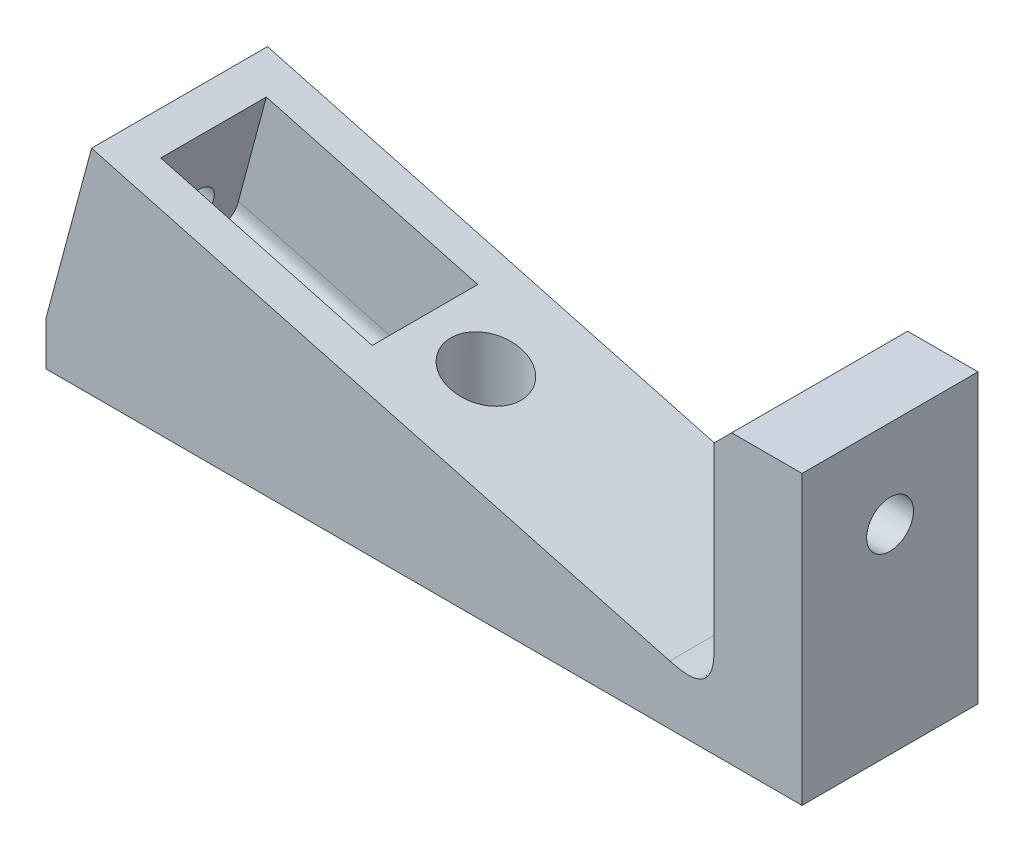
from build123d import *

# Parameters (mm, degrees)
BOSS_EXTRUDE2_DEPTH         = 12.7
CUT_EXTRUDE1_DEPTH          = 7.62
SKETCH3_R                   = 3.3
CUT_EXTRUDE3_DEPTH          = 5.08
FILLET1_SIZE                = 2.54
F_1_4_CLEARANCE_HOLE1_D     = 6.7564
SKETCH8_R                   = 5.08
CUT_EXTRUDE4_DEPTH          = 125.929525349
CUT_EXTRUDE5_DEPTH          = 129.230913422
BOSS_EXTRUDE3_DEPTH         = 25.4
F_1_4_CLEARANCE_HOLE2_D     = 6.7564
F_1_4_CLEARANCE_HOLE2_DEPTH = 12.7
F_1_4_CLEARANCE_HOLE2_TIP   = 2.029827343
SKETCH14_R                  = 5.08
CUT_EXTRUDE6_DEPTH          = 6.604
CHAMFER1_SIZE               = 2.54


with BuildPart() as part:
    # Sketch1 → Boss-Extrude2 (new, symmetric)
    with BuildSketch(Plane.XY):
        Polygon((-121.836586579, 6.35), (-121.836586579, 0), (0, 0), (-115.262582833, 30.884515988), align=None)
    extrude(amount=BOSS_EXTRUDE2_DEPTH, both=True)

    # Sketch2 → Cut-Extrude1 (cut, symmetric)
    with BuildSketch(Plane.XY):
        Polygon((-112.78857866, 20.490012472), (-112.245058665, 22.518456707), (-106.256318542, 20.913778627), (-109.051564229, 10.481779703), (-115.040304352, 12.086457783), (-114.496784358, 14.114902018), align=None)
        Polygon((-79.832423525, 21.391033413), (-110.355679636, 29.569715239), (-112.245058665, 22.518456707), (-106.256318542, 20.913778627), (-109.051564229, 10.481779703), (-84.517048242, 3.907775958), align=None)
    extrude(amount=CUT_EXTRUDE1_DEPTH, both=True, mode=Mode.SUBTRACT)

    # Sketch3 → Cut-Extrude3 (cut)
    with BuildSketch(Plane(origin=(-115.262582833, 30.884515988, 0), x_dir=(0, 0, 1), z_dir=(-0.96592582628907, 0.25881904510251447, 0))):
        with Locations(Location((0, -12.7, 0), (0, 0, 270))):
            Circle(SKETCH3_R)
    extrude(amount=-CUT_EXTRUDE3_DEPTH, mode=Mode.SUBTRACT)

    # Fillet1
    # a fillet whose section is not a circle: 2.54 mm, written as the material it adds along each edge
    with BuildSketch(Plane(origin=(-84.517048242, 3.907775958, 7.62), x_dir=(0.25881904510251297, 0.9659258262890703, 0), z_dir=(0, 0, -1))) as fillet1_piece_1:
        with BuildLine():
            add(Edge.make_bspline([(FILLET1_SIZE, 0), (FILLET1_SIZE * 0.831801948466, 0), (FILLET1_SIZE * 0.663603896932, 0), (FILLET1_SIZE * 0.292893218813, -FILLET1_SIZE * 0.0716919198361), (FILLET1_SIZE * 0.0716919198361, -FILLET1_SIZE * 0.292893218813), (0, -FILLET1_SIZE * 0.663603896932), (0, -FILLET1_SIZE * 0.831801948466), (0, -FILLET1_SIZE)], knots=[0, 0, 0, 0, 0, 0, 0.5, 0.5, 1, 1, 1, 1, 1, 1], degree=5))
            Line((0, -FILLET1_SIZE), (0, 0))
            Line((0, 0), (FILLET1_SIZE, 0))
        make_face()
    extrude(amount=15.24)
    with BuildSketch(Plane(origin=(-115.040304352, 12.086457783, 7.62), x_dir=(0.25881904510251585, 0.9659258262890695, 0), z_dir=(0.9659258262890696, -0.2588190451025158, 0))) as fillet1_piece_2:
        with BuildLine():
            add(Edge.make_bspline([(FILLET1_SIZE, 0), (FILLET1_SIZE * 0.831801948466, 0), (FILLET1_SIZE * 0.663603896932, 0), (FILLET1_SIZE * 0.292893218813, -FILLET1_SIZE * 0.0716919198361), (FILLET1_SIZE * 0.0716919198361, -FILLET1_SIZE * 0.292893218813), (0, -FILLET1_SIZE * 0.663603896932), (0, -FILLET1_SIZE * 0.831801948466), (0, -FILLET1_SIZE)], knots=[0, 0, 0, 0, 0, 0, 0.5, 0.5, 1, 1, 1, 1, 1, 1], degree=5))
            Line((0, -FILLET1_SIZE), (0, 0))
            Line((0, 0), (FILLET1_SIZE, 0))
        make_face()
    extrude(amount=37.95)
    with BuildSketch(Plane(origin=(-115.040304352, 12.086457783, -7.62), x_dir=(0.25881904510251585, 0.9659258262890695, 0), z_dir=(0.9659258262890696, -0.2588190451025158, 0))) as fillet1_piece_3:
        with BuildLine():
            add(Edge.make_bspline([(FILLET1_SIZE, 0), (FILLET1_SIZE * 0.831801948466, 0), (FILLET1_SIZE * 0.663603896932, 0), (FILLET1_SIZE * 0.292893218813, FILLET1_SIZE * 0.0716919198361), (FILLET1_SIZE * 0.0716919198361, FILLET1_SIZE * 0.292893218813), (0, FILLET1_SIZE * 0.663603896932), (0, FILLET1_SIZE * 0.831801948466), (0, FILLET1_SIZE)], knots=[0, 0, 0, 0, 0, 0, 0.5, 0.5, 1, 1, 1, 1, 1, 1], degree=5))
            Line((0, FILLET1_SIZE), (0, 0))
            Line((0, 0), (FILLET1_SIZE, 0))
        make_face()
    extrude(amount=37.95)

    # 1/4 Clearance Hole1 (through all)
    with Locations(Plane(origin=(0, 0, 0), x_dir=(-1, 0, 0), z_dir=(0, -1, 0))):
        with Locations((71.036586579, 0)):
            Hole(F_1_4_CLEARANCE_HOLE1_D / 2)

    # Sketch8 → Cut-Extrude4 (cut, through all)
    with BuildSketch(Plane(origin=(0, 6.35, 0), x_dir=(-1, 0, 0), z_dir=(0, -1, 0))):
        with Locations(Location((71.036586579, 0, 0), (0, 0, 90))):
            Circle(SKETCH8_R)
    extrude(amount=-CUT_EXTRUDE4_DEPTH, mode=Mode.SUBTRACT)

    # Sketch9 → Cut-Extrude5 (cut, through all)
    with BuildSketch(Plane.XY.offset(12.7)):
        Polygon((-12.7, 3.402954744), (-12.7, 0), (0, 0), align=None)
    extrude(amount=-CUT_EXTRUDE5_DEPTH, mode=Mode.SUBTRACT)

    # Sketch10 → Boss-Extrude3 (add)
    with BuildSketch(Plane.XY.offset(12.7)):
        Polygon((-12.7, 3.402954744), (-12.7, 41.502954744), (-25.4, 41.502954744), (-25.4, 6.805909488), align=None)
    extrude(amount=-BOSS_EXTRUDE3_DEPTH)

    # 1/4 Clearance Hole2
    with Locations(Plane(origin=(-12.7, 0, 0), x_dir=(0, 0, -1), z_dir=(1, 0, 0))):
        with Locations((0, 28.802954744)):
            Hole(F_1_4_CLEARANCE_HOLE2_D / 2, depth=F_1_4_CLEARANCE_HOLE2_DEPTH)
            with Locations((0, 0, -(F_1_4_CLEARANCE_HOLE2_DEPTH + F_1_4_CLEARANCE_HOLE2_TIP / 2))):  # 118° drill point
                Cone(0, F_1_4_CLEARANCE_HOLE2_D / 2, F_1_4_CLEARANCE_HOLE2_TIP, mode=Mode.SUBTRACT)

    # Sketch14 → Cut-Extrude6 (cut)
    with BuildSketch(Plane.ZY.offset(25.4)):
        with Locations(Location((0, 28.802954744, 0), (0, 0, 270))):
            Circle(SKETCH14_R)
    extrude(amount=-CUT_EXTRUDE6_DEPTH, mode=Mode.SUBTRACT)

    # Chamfer1
    chamfer1_edges = [part.edges().sort_by_distance(p)[0] for p in [
        (-25.4, 41.502954744, 0),
    ]]
    chamfer(chamfer1_edges, length=CHAMFER1_SIZE)

    # Fillet2
    # a fillet whose section is not a circle: 5.08 mm, written as the material it adds along each edge (its section moved 0.00015 mm through the faces so that the kernel can cut it)
    with BuildSketch(Plane(origin=(-25.4, 6.805909488, 12.7), x_dir=(2.2657292946534733e-05, 0.9999999997433235, 0), z_dir=(0, 0, -1))) as fillet2_piece_1:
        with BuildLine():
            add(Edge.make_bspline([(6.620384896, 0), (5.560159502, 2.4022e-05), (4.499934108, 4.8044e-05), (2.201778974, -0.538520049), (1.089942696, -1.987425322), (1.164425276, -4.346667776), (1.438808597, -5.370773083), (1.713191917, -6.39487839)], knots=[0, 0, 0, 0, 0, 0, 0.5, 0.5, 1, 1, 1, 1, 1, 1], degree=5))
            Line((1.713191917, -6.39487839), (1.615053258, -6.421172181))
            ThreePointArc((1.615053258, -6.421172181), (0.758529744, -3.223713577), (-0.09813866, -0.026293791))
            Line((-0.09813866, -0.026293791), (2.302e-06, 0.1016))
            ThreePointArc((2.302e-06, 0.1016), (3.310194748, 0.101525), (6.620387198, 0.1016))
            Line((6.620387198, 0.1016), (6.620384896, 0))
        make_face()
    extrude(amount=25.4)


solid = part.part
